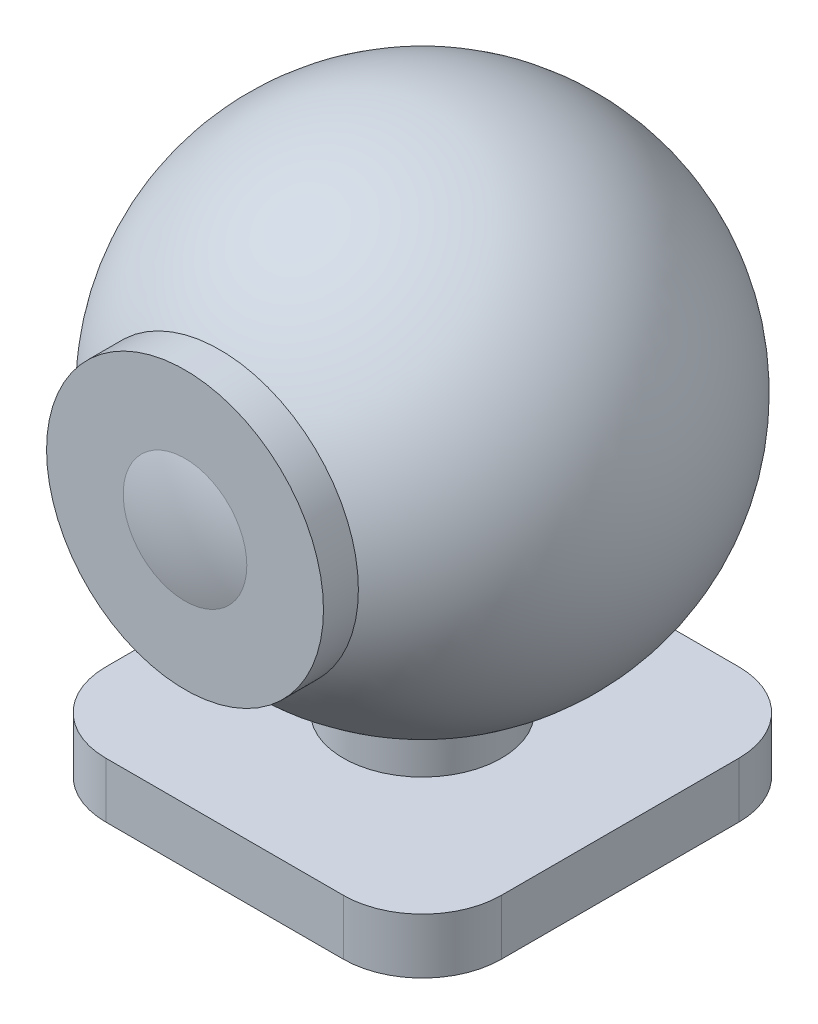
from build123d import *

# Parameters (mm, degrees)
ESQUISSE3_R          = 17.5
EXTRUSION1_DEPTH     = 10
EXTRUSION3_START     = -35
EXTRUSION3_OUTLINE_R = 10
EXTRUSION3_DEPTH     = 7
ESQUISSE7_W          = 50
ESQUISSE7_H          = 50
EXTRUSION4_DEPTH     = 7
CONG_1_R             = 10


# Read off the part's stored shape, not the designer's step: Extrusion3
with BuildPart() as part:
    # Esquisse1 → Révol.-Mince1 (revolve)
    with BuildSketch(Plane.XY):
        with BuildLine():
            ThreePointArc((0, -30), (30, 0), (0, 30))
            Line((0, 30), (0, 31))
            ThreePointArc((0, 31), (31, 0), (0, -31))
            Line((0, -31), (0, -30))
        make_face()
    revolve(axis=Axis((0, 52.542035398, 0), (0, -1, 0)))

    # Esquisse3 → Extrusion1 (add)
    with BuildSketch(Plane.XY.offset(20)):
        with Locations(Location((0, 0, 0), (0, 0, 180))):
            Circle(ESQUISSE3_R)
    extrude(amount=EXTRUSION1_DEPTH)

    # Extrusion3 outline → Extrusion3 (add)
    with BuildSketch(Plane(origin=(0, 0, 0), x_dir=(1, 0, 0), z_dir=(0, 1, 0)).offset(EXTRUSION3_START)):
        Circle(EXTRUSION3_OUTLINE_R)
    extrude(amount=EXTRUSION3_DEPTH)

    # Esquisse7 → Extrusion4 (add)
    with BuildSketch(Plane.XZ.offset(35)):
        Rectangle(ESQUISSE7_W, ESQUISSE7_H)
    extrude(amount=EXTRUSION4_DEPTH)

    # Congé1
    cong_1_edges = [part.edges().sort_by_distance(p)[0] for p in [
        (25, -38.5, -25),
        (25, -38.5, 25),
        (-25, -38.5, 25),
        (-25, -38.5, -25),
    ]]
    fillet(cong_1_edges, radius=CONG_1_R)


solid = part.part
